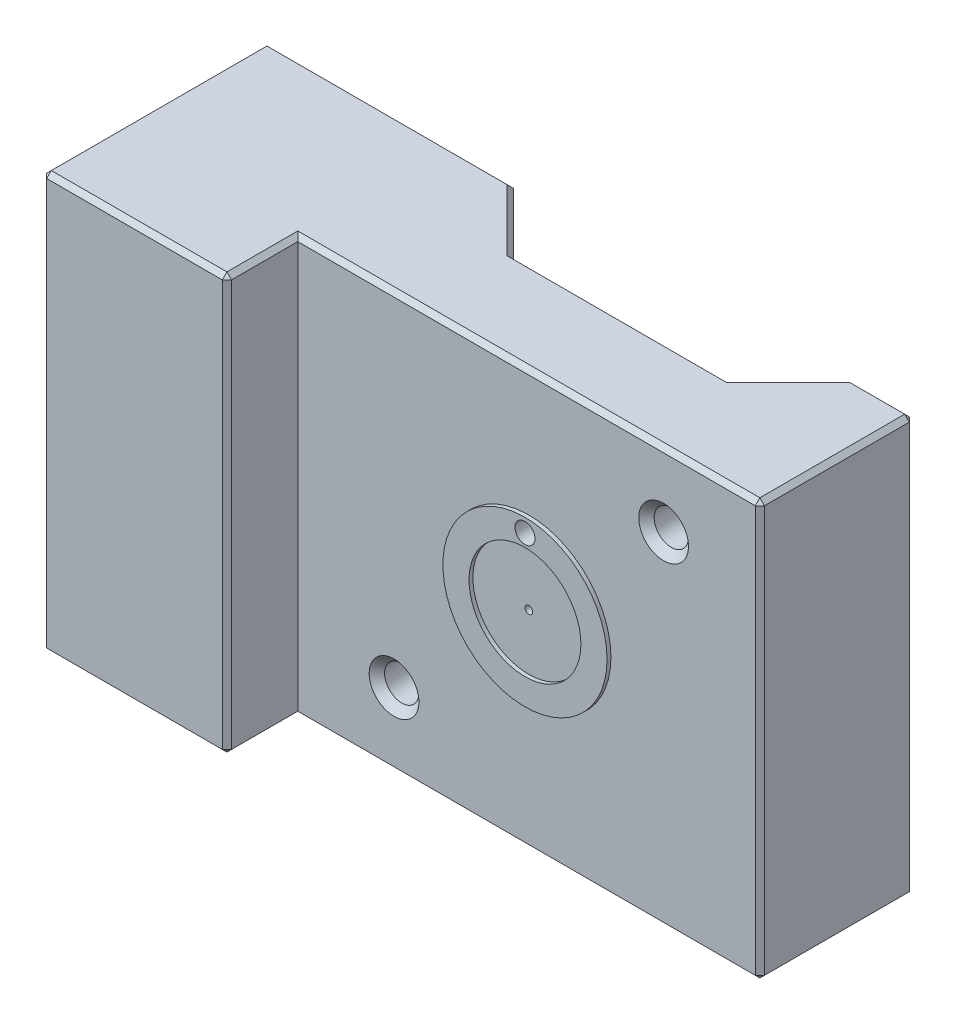
from build123d import *

# Parameters (mm, degrees)
SKETCH1_W               = 30
SKETCH1_H               = 27
BOSS_EXTRUDE1_DEPTH     = 10
SKETCH2_R               = 1.115
CUT_EXTRUDE1_DEPTH      = 10
SKETCH2_4_R             = 5.329276436
SKETCH2_4_R_2           = 3.631824093
BOSS_EXTRUDE2_DEPTH     = 0.25
SKETCH2_5_R             = 0.25
CUT_EXTRUDE2_DEPTH      = 10
SKETCH4_R               = 0.65
CUT_EXTRUDE3_DEPTH      = 3
SKETCH5_W               = 14.6
SKETCH5_H               = 27
BOSS_EXTRUDE3_DEPTH     = 12
CUT_EXTRUDE4_DEPTH      = 12
CUT_EXTRUDE4_DEPTH_BACK = 15
SKETCH3_R               = 1.5
SKETCH7_R               = 4.2164
CUT_EXTRUDE5_DEPTH      = 9.8
SKETCH8_W               = 22
SKETCH8_H               = 27
CUT_EXTRUDE6_DEPTH      = 4
CHAMFER1_SIZE           = 4
SKETCH9_R               = 2
CUT_EXTRUDE7_DEPTH      = 2.5
CHAMFER2_SIZE           = 2.5
CHAMFER3_SIZE           = 0.3
CHAMFER4_SIZE           = 0.5


# Some blends are built 0.0001 mm under size
with BuildPart() as part:
    # Sketch1 → Boss-Extrude1 (new body)
    with BuildSketch(Plane.XY):
        with Locations((12, -10.5)):
            Rectangle(SKETCH1_W, SKETCH1_H)
    extrude(amount=-BOSS_EXTRUDE1_DEPTH)

    # Sketch2 → Cut-Extrude1 (cut)
    with BuildSketch(Plane.XY):
        with Locations((20.75, -1.75)):
            Circle(SKETCH2_R)
        with Locations((3.25, -19.25)):
            Circle(SKETCH2_R)
    extrude(amount=-CUT_EXTRUDE1_DEPTH, mode=Mode.SUBTRACT)

    # Sketch2<4> → Boss-Extrude2 (add)
    with BuildSketch(Plane.XY):
        with Locations((12, -10.5)):
            Circle(SKETCH2_4_R)
        with Locations((12, -10.5)):
            Circle(SKETCH2_4_R_2, mode=Mode.SUBTRACT)
    extrude(amount=BOSS_EXTRUDE2_DEPTH)

    # Sketch2<5> → Cut-Extrude2 (cut)
    with BuildSketch(Plane.XY):
        with Locations((12, -10.5)):
            Circle(SKETCH2_5_R)
    extrude(amount=-CUT_EXTRUDE2_DEPTH, mode=Mode.SUBTRACT)

    # Sketch4 → Cut-Extrude3 (cut)
    with BuildSketch(Plane.XY.offset(0.25)):
        with Locations((12, -6.055)):
            Circle(SKETCH4_R)
    extrude(amount=-CUT_EXTRUDE3_DEPTH, mode=Mode.SUBTRACT)

    # Sketch5 → Boss-Extrude3 (add)
    with BuildSketch(Plane.ZY.offset(3)):
        with Locations((-2.7, -10.5)):
            Rectangle(SKETCH5_W, SKETCH5_H)
    extrude(amount=BOSS_EXTRUDE3_DEPTH)

    # Sketch3 → Cut-Extrude4 (cut, two sides: drawn at the far end of the back side and taken through both)
    with BuildSketch(Plane.ZY.offset(3).offset(-CUT_EXTRUDE4_DEPTH_BACK)):
        with Locations((-2.7, -6.7)):
            Circle(SKETCH3_R)
    extrude(amount=CUT_EXTRUDE4_DEPTH + CUT_EXTRUDE4_DEPTH_BACK, mode=Mode.SUBTRACT)

    # Sketch7 → Cut-Extrude5 (cut)
    with BuildSketch(Plane.ZY.offset(15)):
        with Locations((-2.7, -6.7)):
            Circle(SKETCH7_R)
    extrude(amount=-CUT_EXTRUDE5_DEPTH, mode=Mode.SUBTRACT)

    # Sketch8 → Cut-Extrude6 (cut)
    with BuildSketch(Plane(origin=(0, 0, -10), x_dir=(-1, 0, 0), z_dir=(0, 0, -1))):
        with Locations((-12, -10.5)):
            Rectangle(SKETCH8_W, SKETCH8_H)
    extrude(amount=-CUT_EXTRUDE6_DEPTH, mode=Mode.SUBTRACT)

    # Chamfer1
    # the kernel refuses this chamfer: 4 mm, written as the material it adds along each edge
    with BuildSketch(Plane(origin=(1, 3, -6), x_dir=(0.9996219169112968, 0, 0.027495876610586275), z_dir=(0, -1, 0))) as chamfer1_piece_1_section:
        Polygon((CHAMFER1_SIZE * 0.999621916911, -CHAMFER1_SIZE * 0.0274958766106), (-CHAMFER1_SIZE * 0.0274958766106, -CHAMFER1_SIZE * 0.999621916911), (0, 0), align=None)
    chamfer1_piece_1 = extrude(amount=27, mode=Mode.PRIVATE)
    chamfer1_piece_1 = chamfer1_piece_1 - Plane(origin=(3.25, -19.25, -7.327035159), x_dir=(1, 0, 0), z_dir=(0, 0, 1)) * Cylinder(1.115, 70, mode=Mode.PRIVATE)
    chamfer1_piece_1 = split(chamfer1_piece_1, bisect_by=Plane(origin=(2.297726003, -10.22672805, -10), z_dir=(0, 0, 1)), keep=Keep.TOP, mode=Mode.PRIVATE)
    add(chamfer1_piece_1)
    with BuildSketch(Plane(origin=(23, -24, -6), x_dir=(0.027495876610586494, 0, -0.9996219169112968), z_dir=(0, 1, 0))) as chamfer1_piece_2_section:
        Polygon((CHAMFER1_SIZE * 0.999621916911, CHAMFER1_SIZE * 0.0274958766106), (-CHAMFER1_SIZE * 0.0274958766106, CHAMFER1_SIZE * 0.999621916911), (0, 0), align=None)
    chamfer1_piece_2 = extrude(amount=27, mode=Mode.PRIVATE)
    chamfer1_piece_2 = split(chamfer1_piece_2, bisect_by=Plane(origin=(21.702275046, -10.773273502, -10), z_dir=(0, 0, 1)), keep=Keep.TOP, mode=Mode.PRIVATE)
    chamfer1_piece_2 = chamfer1_piece_2 - Plane(origin=(20.75, -1.75, -7.327035315), x_dir=(1, 0, 0), z_dir=(0, 0, 1)) * Cylinder(1.115, 70, mode=Mode.PRIVATE)
    add(chamfer1_piece_2)

    # Sketch9 → Cut-Extrude7 (cut)
    with BuildSketch(Plane(origin=(0, 0, -6), x_dir=(-1, 0, 0), z_dir=(0, 0, -1))):
        with Locations((-12, -10.5)):
            Circle(SKETCH9_R)
    extrude(amount=-CUT_EXTRUDE7_DEPTH, mode=Mode.SUBTRACT)

    # Chamfer2
    chamfer2_edges = [part.edges().sort_by_distance(p)[0] for p in [
        (14, -10.5, -6),
    ]]
    chamfer(chamfer2_edges, length=CHAMFER2_SIZE - 0.0001)  # a hair under: the kernel refuses the full size

    # Chamfer3
    chamfer3_edges = [part.edges().sort_by_distance(p)[0] for p in [
        (3, -24, -8),
        (27, -10.5, -10),
        (-7, 3, -10),
        (-3, -24, 2.3),
        (-3, -10.5, 4.6),
        (-9, -24, 4.6),
        (-3, 3, 2.3),
        (-9, 3, 4.6),
        (-15, -10.5, -10),
        (-15, -24, -2.7),
        (-15, -10.5, 4.6),
        (-15, 3, -2.7),
        (12, 3, 0),
        (27, -10.5, 0),
        (12, -24, 0),
        (25, -24, -10),
        (25, 3, -10),
        (27, 3, -5),
        (27, -24, -5),
        (-7, -24, -10),
        (12, -24, -6),
        (12, 3, -6),
        (21, -24, -8),
        (21, 3, -8),
        (3, 3, -8),
    ]]
    chamfer(chamfer3_edges, length=CHAMFER3_SIZE)

    # Chamfer4
    chamfer4_edges = [part.edges().sort_by_distance(p)[0] for p in [
        (2.135, -19.25, 0),
        (19.635, -1.75, 0),
    ]]
    chamfer(chamfer4_edges, length=CHAMFER4_SIZE)


solid = part.part
